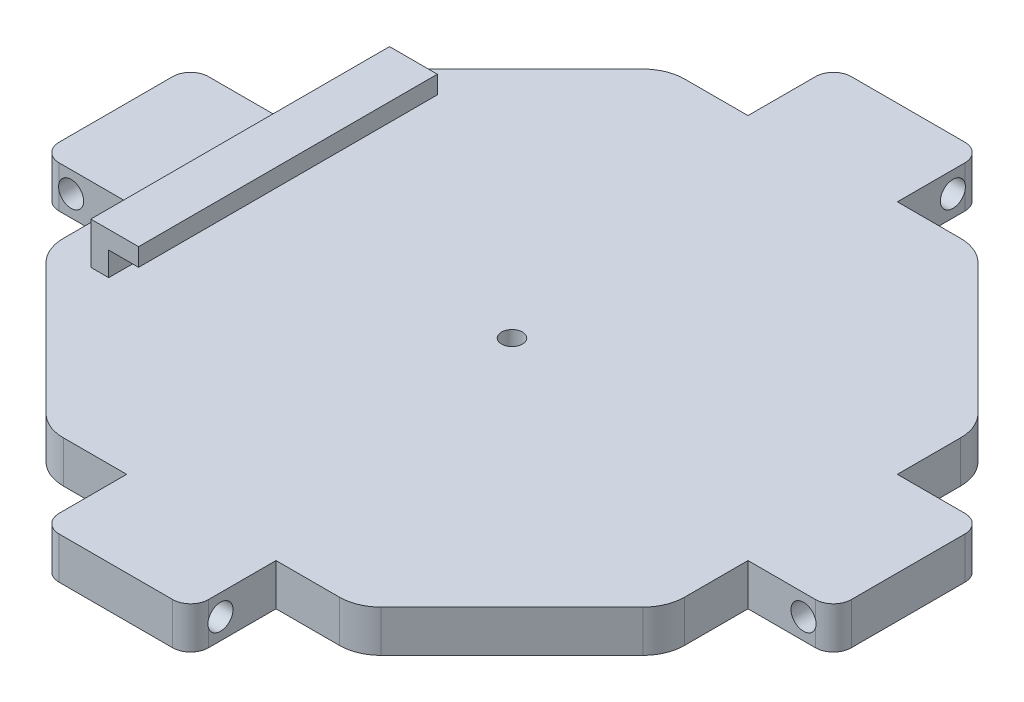
from build123d import *

# Parameters (mm, degrees)
SKETCH_1_W          = 14.3
SKETCH_1_H          = 25
SKETCH_1_W_2        = 25
SKETCH_1_H_2        = 14.3
EXTRUDE_1_DEPTH     = 7
FILLET_1_R          = 3
FILLET_2_R          = 7
FILLET_3_R          = 23
EXTRUDE_START       = -5
EXTRUDE_2_DEPTH     = 5
SKETCH_7_R          = 1.75
CUT_EXTRUDE_5_DEPTH = 95.023294986
SKETCH_9_W          = 3
SKETCH_9_H          = 50
EXTRUDE_3_DEPTH     = 7
SKETCH_10_W         = 50
SKETCH_10_H         = 3
EXTRUDE_4_DEPTH     = 5
SKETCH_11_R         = 2.1
CUT_EXTRUDE_6_DEPTH = 104.928485027
SKETCH_12_R         = 2.1
CUT_EXTRUDE_7_DEPTH = 104.928485103


with BuildPart() as part:
    # 스케치1 → 보스-돌출1 (new body)
    with BuildSketch(Plane(origin=(0, 0, 0), x_dir=(1, 0, 0), z_dir=(0, 1, 0))):
        Polygon((-26, 52), (-39, 39), (-26, 39), (26, 39), (39, 39), (26, 52), (12.5, 52), (-12.5, 52), align=None)
        Polygon((-26, 39), (-39, 39), (-39, 26), align=None)
        Polygon((-39, 26), (-39, 39), (-52, 26), (-52, 12.5), (-52, -12.5), (-52, -26), (-39, -39), (-39, -26), align=None)
        with Locations((-59.15, 0)):
            Rectangle(SKETCH_1_W, SKETCH_1_H)
        with Locations((0, 59.15)):
            Rectangle(SKETCH_1_W_2, SKETCH_1_H_2)
        Polygon((39, 39), (26, 39), (39, 26), align=None)
        Polygon((52, 26), (39, 39), (39, 26), (39, -26), (39, -39), (52, -26), (52, -12.5), (52, 12.5), align=None)
        with Locations((59.15, 0)):
            Rectangle(SKETCH_1_W, SKETCH_1_H)
        Polygon((39, -39), (39, -26), (26, -39), align=None)
        Polygon((-26, -39), (-39, -39), (-26, -52), (-12.5, -52), (12.5, -52), (26, -52), (39, -39), (26, -39), align=None)
        Polygon((-26, -39), (-39, -26), (-39, -39), align=None)
        with Locations((0, -59.15)):
            Rectangle(SKETCH_1_W_2, SKETCH_1_H_2)
    extrude(amount=EXTRUDE_1_DEPTH)

    # 필렛1
    fillet_1_edges = [part.edges().sort_by_distance(p)[0] for p in [
        (12.5, 3.5, 66.3),
        (-12.5, 3.5, 66.3),
        (-66.3, 3.5, 12.5),
        (-66.3, 3.5, -12.5),
        (-12.5, 3.5, -66.3),
        (12.5, 3.5, -66.3),
        (66.3, 3.5, -12.5),
        (66.3, 3.5, 12.5),
    ]]
    fillet(fillet_1_edges, radius=FILLET_1_R)

    # 필렛2
    fillet_2_edges = [part.edges().sort_by_distance(p)[0] for p in [
        (-26, 3.5, 52),
        (-52, 3.5, 26),
        (-52, 3.5, -26),
        (-26, 3.5, -52),
        (26, 3.5, -52),
        (52, 3.5, -26),
        (52, 3.5, 26),
        (26, 3.5, 52),
    ]]
    fillet(fillet_2_edges, radius=FILLET_2_R)

    # 필렛3
    # the kernel refuses this fillet: 23 mm, written as the material it adds along each edge
    with BuildSketch(Plane(origin=(-39, 0, 26), x_dir=(0, 0, -1), z_dir=(0, 1, 0))) as fillet_3_piece_1:
        with BuildLine():
            CenterArc((FILLET_3_R * 0.414213562373, -FILLET_3_R), FILLET_3_R, 90, 45)
            Line((-FILLET_3_R * 0.292893218813, -FILLET_3_R * 0.292893218813), (0, 0))
            Line((0, 0), (FILLET_3_R * 0.414213562373, 0))
        make_face()
    extrude(amount=7)
    with BuildSketch(Plane(origin=(-26, 0, 39), x_dir=(1, 0, 0), z_dir=(0, 1, 0)), Plane(origin=(26, 0, 39), x_dir=(0.7071067811865479, 0, -0.7071067811865471), z_dir=(0, 1, 0)), Plane(origin=(39, 0, 26), x_dir=(0, 0, -1), z_dir=(0, 1, 0)), Plane(origin=(39, 0, -26), x_dir=(-0.7071067811865476, 0, -0.7071067811865476), z_dir=(0, 1, 0)), Plane(origin=(26, 0, -39), x_dir=(-1, 0, 0), z_dir=(0, 1, 0)), Plane(origin=(-26, 0, -39), x_dir=(-0.7071067811865471, 0, 0.7071067811865479), z_dir=(0, 1, 0)), Plane(origin=(-39, 0, -26), x_dir=(0, 0, 1), z_dir=(0, 1, 0))) as fillet_3_piece_2:
        with BuildLine():
            CenterArc((FILLET_3_R * 0.414213562373, FILLET_3_R), FILLET_3_R, 225, 45)
            Line((-FILLET_3_R * 0.292893218813, FILLET_3_R * 0.292893218813), (0, 0))
            Line((0, 0), (FILLET_3_R * 0.414213562373, 0))
        make_face()
    extrude(amount=7)

    # 스케치6 → 보스-돌출2 (add)
    with BuildSketch(Plane(origin=(0, 7, 0), x_dir=(1, 0, 0), z_dir=(0, 1, 0)).offset(EXTRUDE_START)):
        with BuildLine():
            Line((16.473088065, 39), (-16.473088065, 39))
            ThreePointArc((-16.473088065, 39), (-25.120040329, 37.312677367), (-32.4982797, 32.4982797))
            ThreePointArc((-32.4982797, 32.4982797), (-37.312677367, 25.120040329), (-39, 16.473088065))
            Line((-39, 16.473088065), (-39, -16.473088065))
            ThreePointArc((-39, -16.473088065), (-37.312677367, -25.120040329), (-32.4982797, -32.4982797))
            ThreePointArc((-32.4982797, -32.4982797), (-25.120040329, -37.312677367), (-16.473088065, -39))
            Line((-16.473088065, -39), (16.473088065, -39))
            ThreePointArc((16.473088065, -39), (25.120040329, -37.312677367), (32.4982797, -32.4982797))
            ThreePointArc((32.4982797, -32.4982797), (37.312677367, -25.120040329), (39, -16.473088065))
            Line((39, -16.473088065), (39, 16.473088065))
            ThreePointArc((39, 16.473088065), (37.312677367, 25.120040329), (32.4982797, 32.4982797))
            ThreePointArc((32.4982797, 32.4982797), (25.120040329, 37.312677367), (16.473088065, 39))
        make_face()
    extrude(amount=EXTRUDE_2_DEPTH)

    # 스케치7 → 컷-돌출5 (cut, through all)
    with BuildSketch(Plane(origin=(0, 7, 0), x_dir=(1, 0, 0), z_dir=(0, 1, 0))):
        with Locations(Location((0, 0, 0), (0, 0, 270))):
            Circle(SKETCH_7_R)
    extrude(amount=-CUT_EXTRUDE_5_DEPTH, mode=Mode.SUBTRACT)

    # 스케치9 → 보스-돌출3 (add)
    with BuildSketch(Plane(origin=(0, 7, 0), x_dir=(1, 0, 0), z_dir=(0, 1, 0))):
        with Locations((-44, 0)):
            Rectangle(SKETCH_9_W, SKETCH_9_H)
    extrude(amount=EXTRUDE_3_DEPTH)

    # 스케치10 → 보스-돌출4 (add)
    with BuildSketch(Plane(origin=(-42.5, 0, 0), x_dir=(0, 0, -1), z_dir=(1, 0, 0))):
        with Locations((0, 12.5)):
            Rectangle(SKETCH_10_W, SKETCH_10_H)
    extrude(amount=EXTRUDE_4_DEPTH)

    # 스케치11 → 컷-돌출6 (cut, through all)
    with BuildSketch(Plane.XY.offset(12.5)):
        with Locations(Location((-61.3, 3.5, 0), (0, 0, 197.752790162))):
            Circle(SKETCH_11_R)
        with Locations(Location((61.3, 3.5, 0), (0, 0, 17.752790162))):
            Circle(SKETCH_11_R)
    extrude(amount=-CUT_EXTRUDE_6_DEPTH, mode=Mode.SUBTRACT)

    # 스케치12 → 컷-돌출7 (cut, through all)
    with BuildSketch(Plane.ZY.offset(12.5)):
        with Locations(Location((-61.3, 3.5, 0), (0, 0, 162.247209838))):
            Circle(SKETCH_12_R)
        with Locations(Location((61.3, 3.5, 0), (0, 0, 17.752790162))):
            Circle(SKETCH_12_R)
    extrude(amount=-CUT_EXTRUDE_7_DEPTH, mode=Mode.SUBTRACT)


solid = part.part
